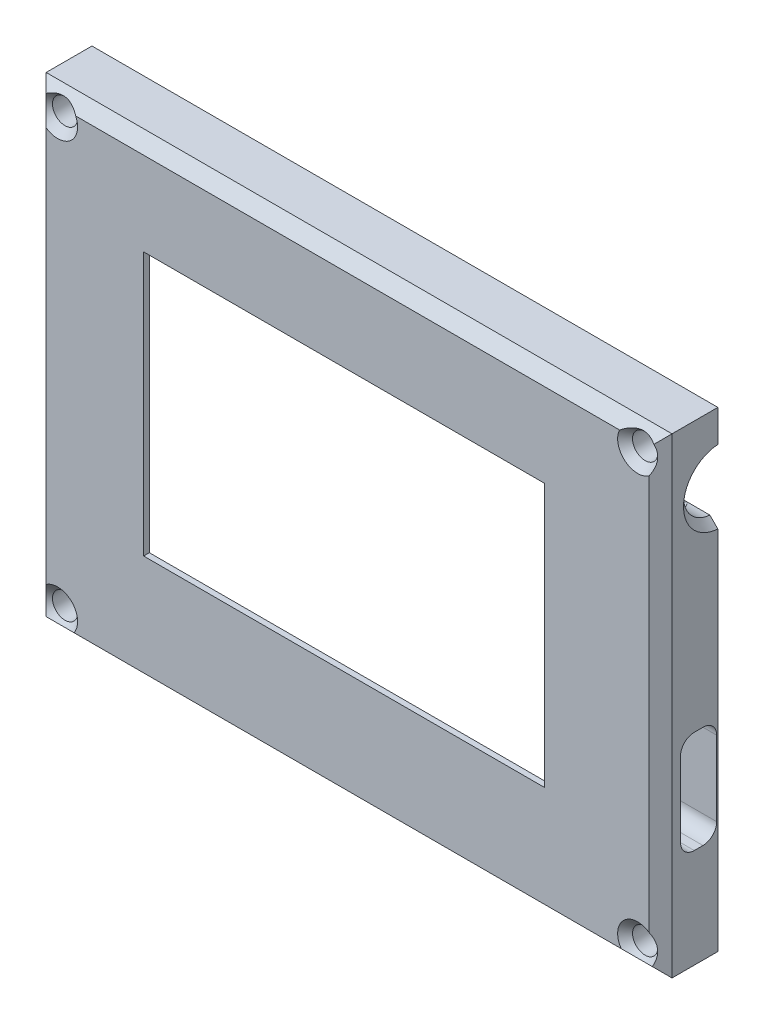
from build123d import *

# Parameters (mm, degrees)
SKETCH1_W                                       = 54.65
SKETCH1_H                                       = 41.15
BOSS_EXTRUDE1_DEPTH                             = 5
SKETCH2_W                                       = 35
SKETCH2_H                                       = 23
CUT_EXTRUDE1_DEPTH                              = 1.5
SKETCH3_W                                       = 47.65
SKETCH3_H                                       = 34.15
CUT_EXTRUDE2_DEPTH                              = 4.5
SKETCH4_R                                       = 2.5
CUT_EXTRUDE3_DEPTH                              = 4
CHAMFER1_SIZE                                   = 0.7
CSK_FOR_M3_FLAT_HEAD_MACHINE_SCREW1_D           = 2.2
CSK_FOR_M3_FLAT_HEAD_MACHINE_SCREW1_DEPTH       = 6
CSK_FOR_M3_FLAT_HEAD_MACHINE_SCREW1_CSINK_D     = 3.5
CSK_FOR_M3_FLAT_HEAD_MACHINE_SCREW1_CSINK_ANGLE = 90
CSK_FOR_M3_FLAT_HEAD_MACHINE_SCREW1_TIP         = 0.660946681
CHAMFER2_SIZE                                   = 1
FILLET3_R                                       = 0.75
CUT_EXTRUDE4_REACH                              = 70.593
SKETCH7_W                                       = 3.26
SKETCH7_H                                       = 8.94
FILLET4_R                                       = 1.2
BOSS_EXTRUDE2_DEPTH                             = 10
BOSS_EXTRUDE2_DEPTH_BACK                        = 0.1
SKETCH8_W                                       = 3.5
SKETCH8_H                                       = 8.94
FILLET5_R                                       = 1.2
CUT_EXTRUDE5_DEPTH                              = 65.35505355
CUT_EXTRUDE5_DEPTH_BACK                         = 65.35505355
SKETCH9_W                                       = 3.5
SKETCH9_H                                       = 10
SKETCH10_W                                      = 4.5
SKETCH10_H                                      = 34.15
CUT_EXTRUDE6_DEPTH                              = 2.3
CUT_EXTRUDE7_START                              = -4.5
SKETCH11_W                                      = 3.064355189
SKETCH11_H                                      = 4.983974318
CUT_EXTRUDE7_DEPTH                              = 4.5
FILLET6_R                                       = 1


with BuildPart() as part:
    # Sketch1 → Boss-Extrude1 (new body)
    with BuildSketch(Plane.XY):
        with Locations((27.325, 20.575)):
            Rectangle(SKETCH1_W, SKETCH1_H)
    extrude(amount=BOSS_EXTRUDE1_DEPTH)

    # Sketch2 → Cut-Extrude1 (cut)
    with BuildSketch(Plane.XY.offset(5)):
        with Locations((27.01, 21.34)):
            Rectangle(SKETCH2_W, SKETCH2_H)
    extrude(amount=-CUT_EXTRUDE1_DEPTH, mode=Mode.SUBTRACT)

    # Sketch3 → Cut-Extrude2 (cut)
    with BuildSketch(Plane(origin=(0, 0, 0), x_dir=(-1, 0, 0), z_dir=(0, 0, -1))):
        with Locations((-27.325, 20.575)):
            Rectangle(SKETCH3_W, SKETCH3_H)
    extrude(amount=-CUT_EXTRUDE2_DEPTH, mode=Mode.SUBTRACT)

    # Sketch4 → Cut-Extrude3 (cut)
    with BuildSketch(Plane(origin=(54.65, 0, 0), x_dir=(0, 0, -1), z_dir=(1, 0, 0))):
        with Locations((0.2, 35.15)):
            Circle(SKETCH4_R)
    extrude(amount=-CUT_EXTRUDE3_DEPTH, mode=Mode.SUBTRACT)

    # Chamfer1
    chamfer1_edges = [part.edges().sort_by_distance(p)[0] for p in [
        (54.65, 35.15, 2.3),
    ]]
    chamfer(chamfer1_edges, length=CHAMFER1_SIZE)

    # CSK for M3 Flat Head Machine Screw1
    with Locations(Plane.XY.offset(5)):
        with Locations((52.65, 2), (2, 39.4), (52.65, 39.4), (2, 2)):
            CounterSinkHole(CSK_FOR_M3_FLAT_HEAD_MACHINE_SCREW1_D / 2, CSK_FOR_M3_FLAT_HEAD_MACHINE_SCREW1_CSINK_D / 2, depth=CSK_FOR_M3_FLAT_HEAD_MACHINE_SCREW1_DEPTH, counter_sink_angle=CSK_FOR_M3_FLAT_HEAD_MACHINE_SCREW1_CSINK_ANGLE)
            with Locations((0, 0, -(CSK_FOR_M3_FLAT_HEAD_MACHINE_SCREW1_DEPTH + CSK_FOR_M3_FLAT_HEAD_MACHINE_SCREW1_TIP / 2))):  # 118° drill point
                Cone(0, CSK_FOR_M3_FLAT_HEAD_MACHINE_SCREW1_D / 2, CSK_FOR_M3_FLAT_HEAD_MACHINE_SCREW1_TIP, mode=Mode.SUBTRACT)

    # Chamfer2
    # the kernel refuses this chamfer: 1 mm, written as the material it takes off along each edge
    with BuildSketch(Plane(origin=(-0.571682988, 41.15, 5), x_dir=(0, -0.9996219169112968, 0.027495876610586414), z_dir=(1, 0, 0))) as chamfer2_piece_1:
        Polygon((CHAMFER2_SIZE * 0.999621916911, CHAMFER2_SIZE * 0.0274958766106), (-CHAMFER2_SIZE * 0.0274958766106, CHAMFER2_SIZE * 0.999621916911), (0, 0), align=None)
    extrude(amount=55.793365976, mode=Mode.SUBTRACT)
    with BuildSketch(Plane(origin=(54.65, 43.721682988, 5), x_dir=(0.02749587661058907, 0, -0.9996219169112965), z_dir=(0, -1, 0)), Plane(origin=(0, -2.571682988, 5), x_dir=(-0.027495876610586365, 0, -0.9996219169112968), z_dir=(0, 1, 0))) as chamfer2_piece_2:
        Polygon((CHAMFER2_SIZE * 0.999621916911, -CHAMFER2_SIZE * 0.0274958766106), (-CHAMFER2_SIZE * 0.0274958766106, -CHAMFER2_SIZE * 0.999621916911), (0, 0), align=None)
    extrude(amount=46.293365976, mode=Mode.SUBTRACT)
    with BuildSketch(Plane(origin=(57.221682988, 0, 5), x_dir=(0, -0.027495876610586365, -0.9996219169112968), z_dir=(-1, 0, 0))) as chamfer2_piece_3:
        Polygon((CHAMFER2_SIZE * 0.999621916911, -CHAMFER2_SIZE * 0.0274958766106), (-CHAMFER2_SIZE * 0.0274958766106, -CHAMFER2_SIZE * 0.999621916911), (0, 0), align=None)
    extrude(amount=59.793365976, mode=Mode.SUBTRACT)

    # Fillet3
    fillet3_edges = [part.edges().sort_by_distance(p)[0] for p in [
        (51.15, 35.15, 2.3),
    ]]
    fillet(fillet3_edges, radius=FILLET3_R)

    # Sketch7 → Cut-Extrude4 (cut, up to next)
    with BuildSketch(Plane(origin=(54.65, 0, 0), x_dir=(0, 0, -1), z_dir=(1, 0, 0)), mode=Mode.PRIVATE) as cut_extrude4_sk1:
        with Locations((-1.63, 13.14)):
            Rectangle(SKETCH7_W, SKETCH7_H)
    cut_extrude4_tool1 = extrude(cut_extrude4_sk1.sketch, amount=-CUT_EXTRUDE4_REACH, mode=Mode.PRIVATE) & part.part
    add(cut_extrude4_tool1.solids().sort_by_distance((54.65, 13.14, 1.63))[0], mode=Mode.SUBTRACT)

    # Fillet4
    fillet4_edges = [part.edges().sort_by_distance(p)[0] for p in [
        (52.9, 8.67, 3.26),
        (52.9, 17.61, 3.26),
    ]]
    fillet(fillet4_edges, radius=FILLET4_R)

    # Sketch8 → Boss-Extrude2 (add, two sides: drawn at the far end of the back side and taken through both)
    with BuildSketch(Plane(origin=(0, 0, 0), x_dir=(-1, 0, 0), z_dir=(0, 0, -1)).offset(-BOSS_EXTRUDE2_DEPTH_BACK)):
        with Locations((-52.9, 13.14)):
            Rectangle(SKETCH8_W, SKETCH8_H)
    extrude(amount=BOSS_EXTRUDE2_DEPTH + BOSS_EXTRUDE2_DEPTH_BACK)

    # Fillet5
    fillet5_edges = [part.edges().sort_by_distance(p)[0] for p in [
        (52.9, 17.61, 0.1),
        (52.9, 8.67, 0.1),
    ]]
    fillet(fillet5_edges, radius=FILLET5_R)

    # Sketch9 → Cut-Extrude5 (cut, two sides: drawn at the far end of the back side and taken through both)
    with BuildSketch(Plane.XZ.offset(-8.67).offset(-CUT_EXTRUDE5_DEPTH_BACK)):
        with Locations((52.9, -5)):
            Rectangle(SKETCH9_W, SKETCH9_H)
    extrude(amount=CUT_EXTRUDE5_DEPTH + CUT_EXTRUDE5_DEPTH_BACK, mode=Mode.SUBTRACT)

    # Sketch10 → Cut-Extrude6 (cut)
    with BuildSketch(Plane(origin=(3.5, 0, 0), x_dir=(0, 0, -1), z_dir=(1, 0, 0))):
        with Locations((-2.25, 20.575)):
            Rectangle(SKETCH10_W, SKETCH10_H)
    extrude(amount=-CUT_EXTRUDE6_DEPTH, mode=Mode.SUBTRACT)

    # Sketch11 → Cut-Extrude7 (cut)
    with BuildSketch(Plane(origin=(0, 0, 0), x_dir=(-1, 0, 0), z_dir=(0, 0, -1)).offset(CUT_EXTRUDE7_START)):
        with Locations((-51.392822405, 35.15)):
            Rectangle(SKETCH11_W, SKETCH11_H)
    extrude(amount=CUT_EXTRUDE7_DEPTH, mode=Mode.SUBTRACT)

    # Fillet6
    # the kernel refuses this fillet: 1 mm, written as the material it adds along each edge
    with BuildSketch(Plane(origin=(52.925, 32.658012841, 7), x_dir=(-1, 0, 0), z_dir=(0, 0, -1))) as fillet6_piece_1_section:
        with BuildLine():
            CenterArc((FILLET6_R, FILLET6_R), FILLET6_R, 180, 90)
            Line((0, FILLET6_R), (0, 0))
            Line((0, 0), (FILLET6_R, 0))
        make_face()
    fillet6_piece_1 = extrude(amount=7, mode=Mode.PRIVATE)
    fillet6_piece_1 = fillet6_piece_1 - Plane(origin=(52.688942882, 35.15, -0.2), x_dir=(0, 0, -1), z_dir=(1, 0, 0)) * Cylinder(2.5, 18, mode=Mode.PRIVATE)
    fillet6_piece_1 = split(fillet6_piece_1, bisect_by=Plane(origin=(52.688942882, 32.861757349, 5), z_dir=(0, 0, -1)), keep=Keep.TOP, mode=Mode.PRIVATE)
    add(fillet6_piece_1)
    with BuildSketch(Plane(origin=(52.925, 30.158012841, 4.5), x_dir=(-1, 0, 0), z_dir=(0, 1, 0))) as fillet6_piece_2:
        with BuildLine():
            CenterArc((FILLET6_R, -FILLET6_R), FILLET6_R, 90, 90)
            Line((0, -FILLET6_R), (0, 0))
            Line((0, 0), (FILLET6_R, 0))
        make_face()
    extrude(amount=7.483974318)
    with BuildSketch(Plane(origin=(52.925, 37.641987159, 7), x_dir=(0, -1, 0), z_dir=(0, 0, -1))) as fillet6_piece_3_section:
        with BuildLine():
            CenterArc((FILLET6_R, FILLET6_R), FILLET6_R, 180, 90)
            Line((0, FILLET6_R), (0, 0))
            Line((0, 0), (FILLET6_R, 0))
        make_face()
    fillet6_piece_3 = extrude(amount=7, mode=Mode.PRIVATE)
    fillet6_piece_3 = fillet6_piece_3 - Plane(origin=(52.688929228, 35.15, -0.2), x_dir=(0, 0, -1), z_dir=(1, 0, 0)) * Cylinder(2.5, 18, mode=Mode.PRIVATE)
    fillet6_piece_3 = split(fillet6_piece_3, bisect_by=Plane(origin=(52.688929228, 37.438232823, 5), z_dir=(0, 0, -1)), keep=Keep.TOP, mode=Mode.PRIVATE)
    add(fillet6_piece_3)


solid = part.part
